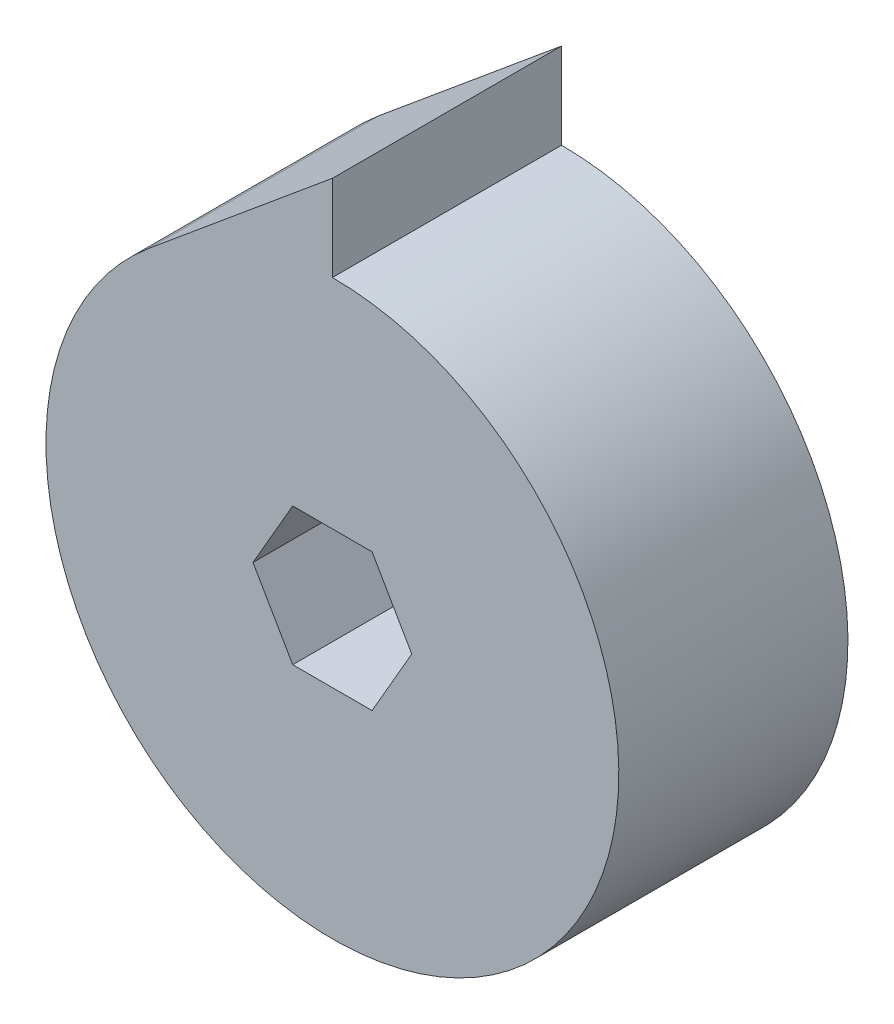
from build123d import *

# Parameters (mm, degrees)
BOSS_EXTRUDE1_DEPTH = 20


with BuildPart() as part:
    # Sketch3 → Boss-Extrude1 (new body)
    with BuildSketch(Plane.XY):
        with BuildLine():
            Line((0, 25), (0, 32.5))
            Line((0, 32.5), (-15.974276659, 19.230769231))
            ThreePointArc((-15.974276659, 19.230769231), (8.492077756, -23.513498578), (0, 25))
        make_face()
        Polygon((6.92820323, 0), (3.464101615, 6), (-3.464101615, 6), (-6.92820323, 0), (-3.464101615, -6), (3.464101615, -6), align=None, mode=Mode.SUBTRACT)
    extrude(amount=BOSS_EXTRUDE1_DEPTH)


solid = part.part
